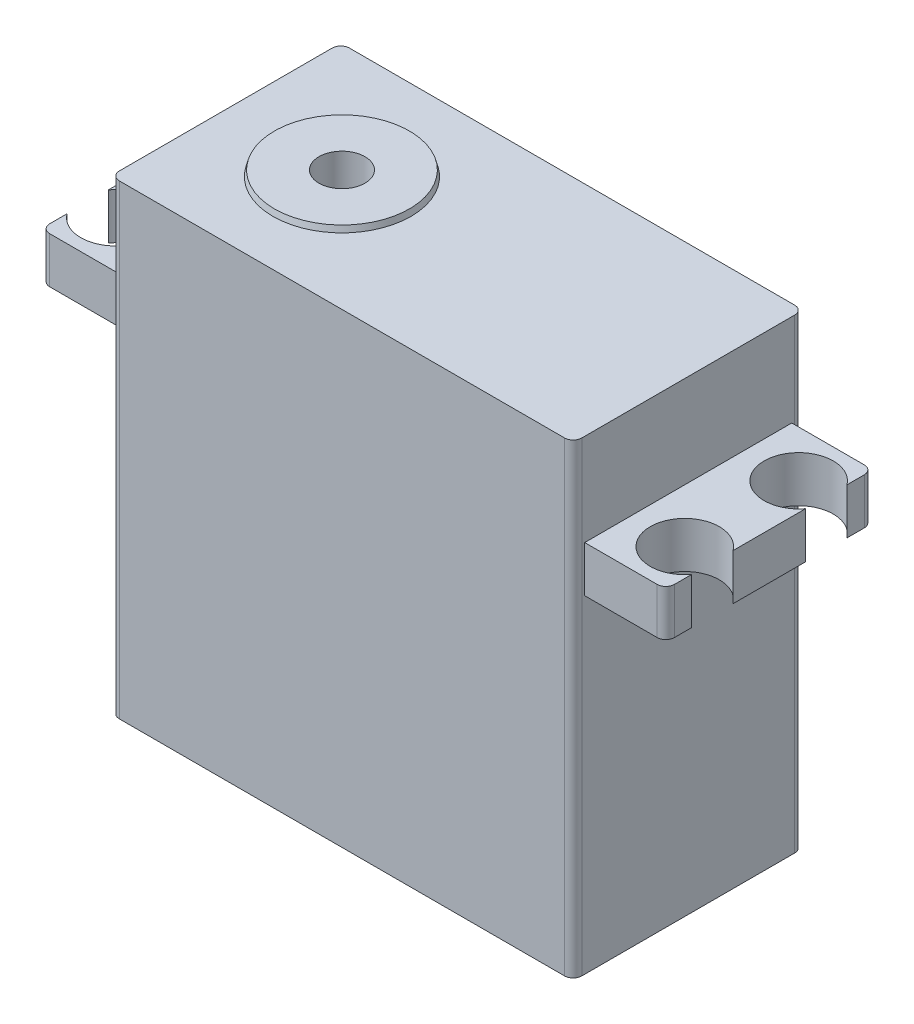
from build123d import *

# Parameters (mm, degrees)
SKETCH1_W           = 40.2
SKETCH1_H           = 20
BOSS_EXTRUDE1_DEPTH = 40.5
SKETCH2_W           = 18
SKETCH2_H           = 2
BOSS_EXTRUDE2_DEPTH = 7.05
SKETCH5_R           = 3
CUT_EXTRUDE1_DEPTH  = 7.05
MIRROR2_START       = 28.5
MIRROR2_DEPTH       = 4
FILLET2_R           = 0.75
SKETCH6_R           = 6
BOSS_EXTRUDE3_DEPTH = 0.5
BOSS_EXTRUDE3_TAPER = 15
SKETCH7_R           = 2
CUT_EXTRUDE3_DEPTH  = 5


# Read off the part's stored shape, not the designer's step: Mirror2
with BuildPart() as part:
    # Sketch1 → Boss-Extrude1 (new body)
    with BuildSketch(Plane(origin=(0, 0, 0), x_dir=(1, 0, 0), z_dir=(0, 1, 0))):
        Rectangle(SKETCH1_W, SKETCH1_H)
    extrude(amount=BOSS_EXTRUDE1_DEPTH)

    # Sketch2 → Boss-Extrude2 (add)
    with BuildSketch(Plane(origin=(20.1, 0, 0), x_dir=(0, 0, -1), z_dir=(1, 0, 0))):
        with Locations((0, 29.5)):
            Rectangle(SKETCH2_W, SKETCH2_H)
    extrude(amount=BOSS_EXTRUDE2_DEPTH)

    # Sketch5 → Cut-Extrude1 (cut)
    with BuildSketch(Plane(origin=(0, 30.5, 0), x_dir=(1, 0, 0), z_dir=(0, 1, 0))):
        with Locations((24.75, 4.95)):
            Circle(SKETCH5_R)
        with Locations((24.75, -4.95)):
            Circle(SKETCH5_R)
    extrude(amount=-CUT_EXTRUDE1_DEPTH, mode=Mode.SUBTRACT)

    # Mirror2 outline → Mirror2 (add)
    with BuildSketch(Plane(origin=(0, 0, 0), x_dir=(1, 0, 0), z_dir=(0, 1, 0)).offset(MIRROR2_START)):
        with BuildLine():
            Line((-27.15, 3.15), (-27.15, -3.15))
            ThreePointArc((-27.15, -3.15), (-21.75, -4.95), (-27.15, -6.75))
            Line((-27.15, -6.75), (-27.15, -9))
            Line((-27.15, -9), (-20.1, -9))
            Line((-20.1, -9), (-20.1, 9))
            Line((-20.1, 9), (-27.15, 9))
            Line((-27.15, 9), (-27.15, 6.75))
            ThreePointArc((-27.15, 6.75), (-21.75, 4.95), (-27.15, 3.15))
        make_face()
        with BuildLine():
            Line((27.15, 6.75), (27.15, 9))
            Line((27.15, 9), (20.1, 9))
            Line((20.1, 9), (20.1, -9))
            Line((20.1, -9), (27.15, -9))
            Line((27.15, -9), (27.15, -6.75))
            ThreePointArc((27.15, -6.75), (21.75, -4.95), (27.15, -3.15))
            Line((27.15, -3.15), (27.15, 3.15))
            ThreePointArc((27.15, 3.15), (21.75, 4.95), (27.15, 6.75))
        make_face()
    extrude(amount=MIRROR2_DEPTH)

    # Fillet2
    fillet2_edges = [part.edges().sort_by_distance(p)[0] for p in [
        (27.15, 30.5, 9),
        (27.15, 30.5, -9),
        (-27.15, 30.5, 9),
        (-27.15, 30.5, -9),
        (20.1, 20.25, 10),
        (-20.1, 20.25, 10),
        (-20.1, 20.25, -10),
        (20.1, 20.25, -10),
    ]]
    fillet(fillet2_edges, radius=FILLET2_R)

    # Sketch6 → Boss-Extrude3 (add)
    with BuildSketch(Plane(origin=(0, 40.5, 0), x_dir=(1, 0, 0), z_dir=(0, 1, 0))):
        with Locations((-10, 0)):
            Circle(SKETCH6_R)
    extrude(amount=BOSS_EXTRUDE3_DEPTH, taper=BOSS_EXTRUDE3_TAPER)

    # Sketch7 → Cut-Extrude3 (cut)
    with BuildSketch(Plane(origin=(0, 41, 0), x_dir=(1, 0, 0), z_dir=(0, 1, 0))):
        with Locations(Location((-10, 0, 0), (0, 0, 270))):
            Circle(SKETCH7_R)
    extrude(amount=-CUT_EXTRUDE3_DEPTH, mode=Mode.SUBTRACT)


solid = part.part
